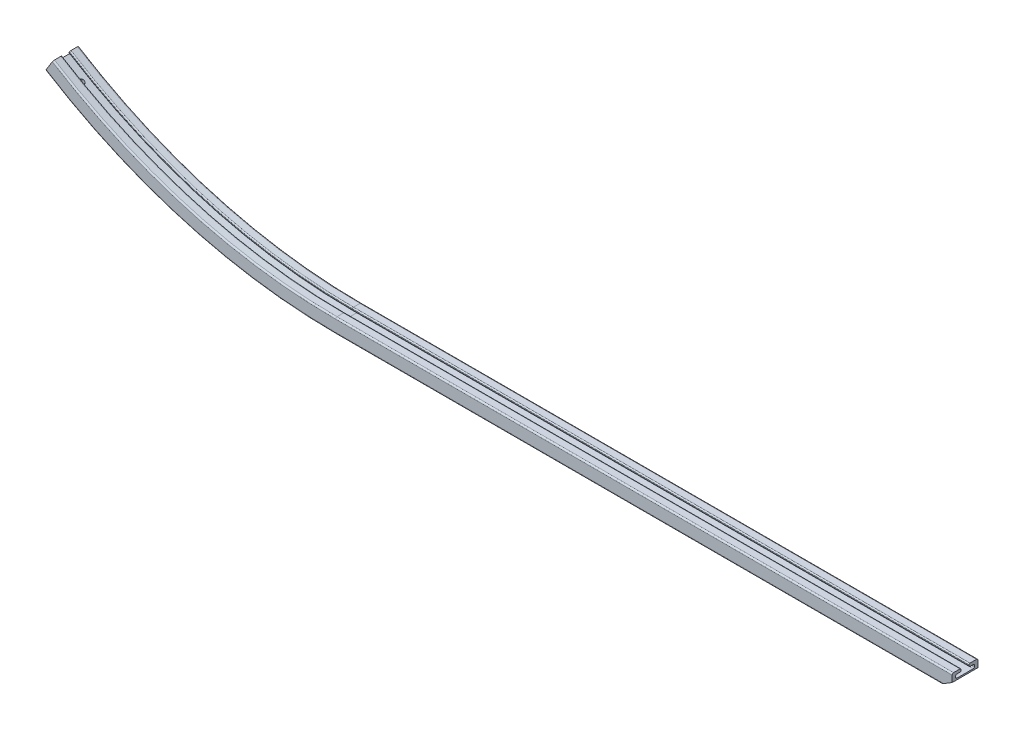
from build123d import *

# Parameters (mm, degrees)
CHAMFER_1_SIZE           = 15
CHAMFER_1_SIZE_2         = 9
CUT_EXTRUDE_1_DEPTH      = 20
CUT_EXTRUDE_1_DEPTH_BACK = 20
SKETCH_3_R               = 3.5
SKETCH_4_R               = 7.5
CUT_EXTRUDE_2_DEPTH      = 10


with BuildPart() as part:
    # По траектории1: sweep along a path in Эскиз1
    with BuildLine(Plane.XY) as sweep_1_path:
        Line((857, 0), (0, 0))
        ThreePointArc((0, 0), (-206.760731281, 29.063109558), (-397.497169801, 114))
    # Эскиз2 → По траектории1 (sweep)
    with BuildSketch(Plane(origin=(857, 0, 0), x_dir=(0, 0, -1), z_dir=(1, 0, 0))):
        with BuildLine():
            Line((11.5, 0), (-11.5, 0))
            ThreePointArc((-11.5, 0), (-12.560660172, 0.439339828), (-13, 1.5))
            Line((-13, 1.5), (-13, 3.5))
            ThreePointArc((-13, 3.5), (-12.560660172, 4.560660172), (-11.5, 5))
            Line((-11.5, 5), (-7, 5))
            ThreePointArc((-7, 5), (-5.939339828, 5.439339828), (-5.5, 6.5))
            Line((-5.5, 6.5), (-5.5, 7.5))
            ThreePointArc((-5.5, 7.5), (-5.939339828, 8.560660172), (-7, 9))
            Line((-7, 9), (-16, 9))
            ThreePointArc((-16, 9), (-17.414213562, 8.414213562), (-18, 7))
            Line((-18, 7), (-18, -9))
            ThreePointArc((-18, -9), (-17.414213562, -10.414213562), (-16, -11))
            Line((-16, -11), (16, -11))
            ThreePointArc((16, -11), (17.414213562, -10.414213562), (18, -9))
            Line((18, -9), (18, 7))
            ThreePointArc((18, 7), (17.414213562, 8.414213562), (16, 9))
            Line((16, 9), (7, 9))
            ThreePointArc((7, 9), (5.939339828, 8.560660172), (5.5, 7.5))
            Line((5.5, 7.5), (5.5, 6.5))
            ThreePointArc((5.5, 6.5), (5.939339828, 5.439339828), (7, 5))
            Line((7, 5), (11.5, 5))
            ThreePointArc((11.5, 5), (12.560660172, 4.560660172), (13, 3.5))
            Line((13, 3.5), (13, 1.5))
            ThreePointArc((13, 1.5), (12.560660172, 0.439339828), (11.5, 0))
        make_face()
    sweep(path=sweep_1_path.line)

    # Фаска1
    # the kernel refuses this chamfer: 15, 9 mm, written as the material it takes off along each edge
    with BuildSketch(Plane(origin=(857, -11, 54.793916458), x_dir=(-0.9998021063601228, -0.019893418958582456, 0), z_dir=(0, 0, -1))) as chamfer_1_piece_1:
        Polygon((CHAMFER_1_SIZE * 0.99980210636, CHAMFER_1_SIZE * 0.0198934189586), (-CHAMFER_1_SIZE_2 * 0.0198934189586, CHAMFER_1_SIZE_2 * 0.99980210636), (0, 0), align=None)
    extrude(amount=109.587832916, mode=Mode.SUBTRACT)

    # Эскиз3 → Вырез-Вытянуть1 (cut, two sides: drawn at the far end of the back side and taken through both)
    with BuildSketch(Plane(origin=(-370.875233434, 98.116911382, 0), x_dir=(0.8691774514901227, -0.4945003112447307, 0), z_dir=(-0.4945003112447307, -0.8691774514901227, 0)).offset(-CUT_EXTRUDE_1_DEPTH_BACK)):
        with Locations(Location((0, 0, 0), (0, 0, 180))):
            Circle(SKETCH_3_R)
    extrude(amount=CUT_EXTRUDE_1_DEPTH + CUT_EXTRUDE_1_DEPTH_BACK, mode=Mode.SUBTRACT)

    # Эскиз4 → Вырез-Вытянуть2 (cut)
    with BuildSketch(Plane(origin=(-50.744094618, -89.192305515, 0), x_dir=(0.8691774514901226, -0.4945003112447307, 0), z_dir=(-0.4945003112447307, -0.8691774514901226, 0))):
        with Locations(Location((-370.875233434, 0, 0), (0, 0, 180))):
            Circle(SKETCH_4_R)
    extrude(amount=CUT_EXTRUDE_2_DEPTH, mode=Mode.SUBTRACT)


solid = part.part
